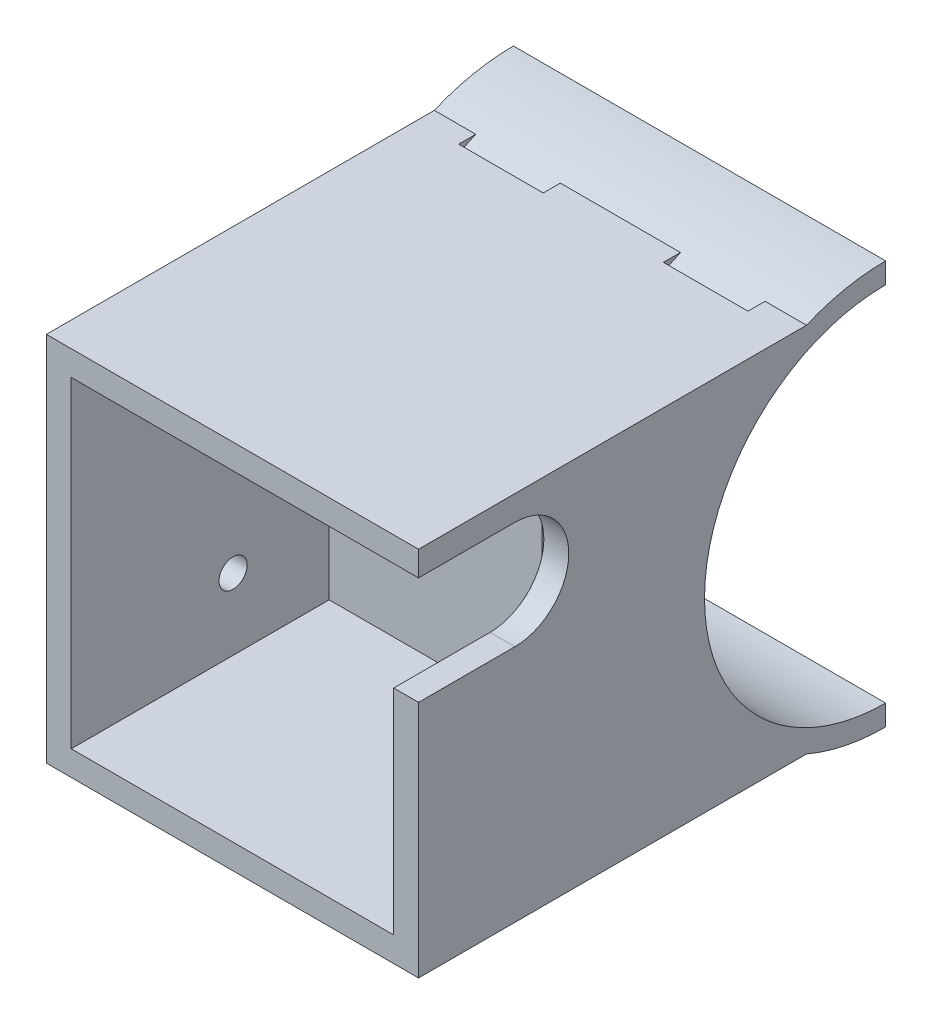
from build123d import *
from build123d.topology import SkipClean

# Parameters (mm, degrees)
BOSS_EXTRUDE1_DEPTH                  = 28.5115
SKETCH5_W                            = 57.023
SKETCH5_H                            = 56.896
SKETCH5_W_2                          = 49.403
SKETCH5_H_2                          = 49.276
BOSS_EXTRUDE2_DEPTH                  = 40.64
BOSS_EXTRUDE2_DIRECTION_2_REACH      = 54.207
BOSS_EXTRUDE2_DIRECTION_2_END_RADIUS = 30.9245
CUT_EXTRUDE1_START                   = -12.954
CUT_EXTRUDE1_DEPTH                   = 12.954
CUT_EXTRUDE2_START                   = -12.954
CUT_EXTRUDE2_DEPTH                   = 12.954
CUT_EXTRUDE3_DEPTH                   = 3.81
BOSS_EXTRUDE3_REACH                  = 59.717
BOSS_EXTRUDE3_END_RADIUS             = 30.9245
SKETCH11_W                           = 15.875
SKETCH11_H                           = 53.086
BOSS_EXTRUDE5_DEPTH                  = 16.764
BOSS_EXTRUDE6_DEPTH                  = 16.764
CUT_EXTRUDE4_START                   = -3.81
CUT_EXTRUDE4_OUTLINE_R               = 2.159
CUT_EXTRUDE4_DEPTH                   = 3.81


# Read off the part's stored shape, not the designer's step: Cut-Extrude4
with BuildPart() as part:
    # Sketch2 → Boss-Extrude1 (new, symmetric)
    with BuildSketch(Plane(origin=(0, 0, 0), x_dir=(0, 0, -1), z_dir=(1, 0, 0))):
        with BuildLine():
            Line((0, -30.9245), (0, -27.7495))
            ThreePointArc((0, -27.7495), (-27.7495, 0), (0, 27.7495))
            Line((0, 27.7495), (0, 30.9245))
            ThreePointArc((0, 30.9245), (-30.9245, 0), (0, -30.9245))
        make_face()
    extrude(amount=BOSS_EXTRUDE1_DEPTH, both=True)

    # Sketch5 → Boss-Extrude2 (add)
    with BuildSketch(Plane.XY.offset(30.9245)):
        Rectangle(SKETCH5_W, SKETCH5_H)
        Rectangle(SKETCH5_W_2, SKETCH5_H_2, mode=Mode.SUBTRACT)
    extrude(amount=BOSS_EXTRUDE2_DEPTH)

    # Boss-Extrude2 direction 2: up to this cylinder (the profile starts outside it)
    boss_extrude2_direction_2_end = Plane(origin=(0, 0, 0), z_dir=(-1, 0, 0)) * Cylinder(BOSS_EXTRUDE2_DIRECTION_2_END_RADIUS, 171.263, mode=Mode.PRIVATE)
    # Sketch5 → Boss-Extrude2 direction 2 (add, up to the surface)
    with BuildSketch(Plane.XY.offset(30.9245), mode=Mode.PRIVATE) as boss_extrude2_direction_2_sk1:
        Rectangle(SKETCH5_W, SKETCH5_H)
        Rectangle(SKETCH5_W_2, SKETCH5_H_2, mode=Mode.SUBTRACT)
    boss_extrude2_direction_2_tool1 = extrude(boss_extrude2_direction_2_sk1.sketch, amount=-BOSS_EXTRUDE2_DIRECTION_2_REACH, mode=Mode.PRIVATE) - boss_extrude2_direction_2_end
    add(boss_extrude2_direction_2_tool1.solids().sort_by_distance((0, 27.642471, 30.9245))[0])
    add(boss_extrude2_direction_2_tool1.solids().sort_by_distance((0, 27.642471, 30.9245))[1])

    # Sketch7 → Cut-Extrude1 (cut)
    with SkipClean():  # the faces are left unmerged after this step: merging them gives an invalid solid
        with BuildSketch(Plane.ZY.offset(-9.2075).offset(CUT_EXTRUDE1_START)):
            with BuildLine():
                Line((0, 30.9245), (0, 32.0421))
                ThreePointArc((0, 32.0421), (32.0421, 0), (0, -32.0421))
                Line((0, -32.0421), (0, -30.9245))
                ThreePointArc((0, -30.9245), (30.9245, 0), (0, 30.9245))
            make_face()
        extrude(amount=CUT_EXTRUDE1_DEPTH, mode=Mode.SUBTRACT)

    # Sketch8 → Cut-Extrude2 (cut)
    with SkipClean():  # the faces are left unmerged after this step: merging them gives an invalid solid
        with BuildSketch(Plane(origin=(-9.2075, 0, 0), x_dir=(0, 0, -1), z_dir=(1, 0, 0)).offset(CUT_EXTRUDE2_START)):
            with BuildLine():
                Line((0, 30.9245), (0, 32.0421))
                ThreePointArc((0, 32.0421), (-32.0421, 0), (0, -32.0421))
                Line((0, -32.0421), (0, -30.9245))
                ThreePointArc((0, -30.9245), (-30.9245, 0), (0, 30.9245))
            make_face()
        extrude(amount=CUT_EXTRUDE2_DEPTH, mode=Mode.SUBTRACT)

    # Sketch10 → Cut-Extrude3 (cut)
    with SkipClean():  # the faces are left unmerged after this step: merging them gives an invalid solid
        with BuildSketch(Plane(origin=(28.5115, 0, 0), x_dir=(0, 0, -1), z_dir=(1, 0, 0))):
            with BuildLine():
                Line((-56.8071, 24.638), (-71.5645, 24.638))
                Line((-71.5645, 24.638), (-71.5645, 8.128))
                Line((-71.5645, 8.128), (-56.8071, 8.128))
                ThreePointArc((-56.8071, 8.128), (-48.5521, 16.383), (-56.8071, 24.638))
            make_face()
        extrude(amount=-CUT_EXTRUDE3_DEPTH, mode=Mode.SUBTRACT)

    # Boss-Extrude3: up to this cylinder (the profile starts outside it)
    with SkipClean():  # the faces are left unmerged after this step: merging them gives an invalid solid
        boss_extrude3_end = Plane(origin=(0, 0, 0), z_dir=(-1, 0, 0)) * Cylinder(BOSS_EXTRUDE3_END_RADIUS, 182.283, mode=Mode.PRIVATE)
        # Sketch11 → Boss-Extrude3 (add, up to the surface)
        with BuildSketch(Plane.XY.offset(32.0421), mode=Mode.PRIVATE) as boss_extrude3_sk1:
            with Locations((0, -1.905)):
                Rectangle(SKETCH11_W, SKETCH11_H)
        boss_extrude3_tool1 = extrude(boss_extrude3_sk1.sketch, amount=-BOSS_EXTRUDE3_REACH, mode=Mode.PRIVATE) - boss_extrude3_end
        add(boss_extrude3_tool1.solids().sort_by_distance((0, -1.905, 32.0421))[0])

    # Sketch15 → Boss-Extrude5 (add)
    with SkipClean():  # the faces are left unmerged after this step: merging them gives an invalid solid
        with BuildSketch(Plane.ZY.offset(7.9375)):
            Polygon((32.0421, -24.638), (24.653467357, -24.638), (32.0421, -10.668), align=None)
            Polygon((24.653467357, 24.638), (32.0421, 10.668), (32.0421, 24.638), align=None)
        extrude(amount=BOSS_EXTRUDE5_DEPTH)

    # Sketch16 → Boss-Extrude6 (add)
    with SkipClean():  # the faces are left unmerged after this step: merging them gives an invalid solid
        with BuildSketch(Plane(origin=(7.9375, 0, 0), x_dir=(0, 0, -1), z_dir=(1, 0, 0))):
            Polygon((-32.0421, -24.638), (-24.653467357, -24.638), (-32.0421, -10.668), align=None)
            Polygon((-24.653467357, 24.638), (-32.0421, 10.668), (-32.0421, 24.638), align=None)
        extrude(amount=BOSS_EXTRUDE6_DEPTH)

    # Cut-Extrude4 outline → Cut-Extrude4 (cut)
    with SkipClean():  # the faces are left unmerged after this step: merging them gives an invalid solid
        with BuildSketch(Plane.ZY.offset(28.5115).offset(CUT_EXTRUDE4_START)):
            with Locations((46.7741, -13.716)):
                Circle(CUT_EXTRUDE4_OUTLINE_R)
            with Locations((46.7741, 14.224)):
                Circle(CUT_EXTRUDE4_OUTLINE_R)
        extrude(amount=CUT_EXTRUDE4_DEPTH, mode=Mode.SUBTRACT)


solid = part.part
